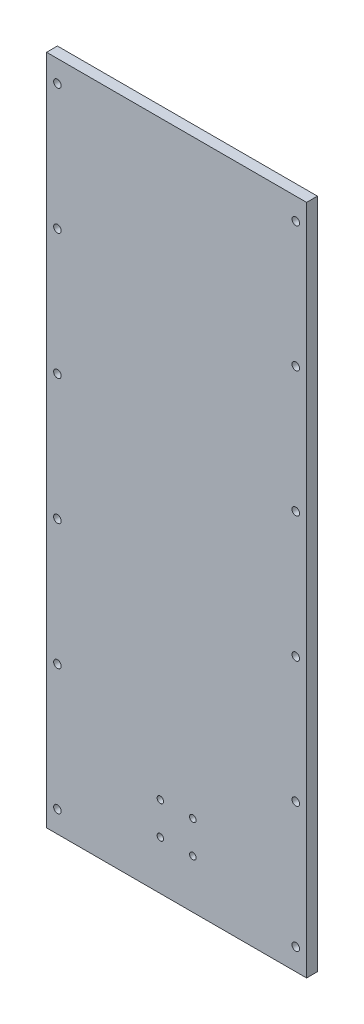
from build123d import *

# Parameters (mm, degrees)
ESQUISSE1_W             = 120
ESQUISSE1_H             = 310
BOSS_EXTRU_1_DEPTH      = 5
ESQUISSE2_R             = 1.747592995
ESQUISSE2_R_2           = 1.5
ENL_V_MAT_EXTRU_1_DEPTH = 10


with BuildPart() as part:
    # Esquisse1 → Boss.-Extru.1 (new body)
    with BuildSketch(Plane.XY):
        Rectangle(ESQUISSE1_W, ESQUISSE1_H)
    extrude(amount=BOSS_EXTRU_1_DEPTH)

    # Esquisse2 → Enlèv. mat.-Extru.1 (cut)
    with BuildSketch(Plane.XY.offset(5)):
        with Locations((-55, 145)):
            Circle(ESQUISSE2_R)
        with Locations((55, 145)):
            Circle(ESQUISSE2_R)
        with Locations((-55, 87)):
            Circle(ESQUISSE2_R)
        with Locations((-55, 29)):
            Circle(ESQUISSE2_R)
        with Locations((-55, -29)):
            Circle(ESQUISSE2_R)
        with Locations((-55, -87)):
            Circle(ESQUISSE2_R)
        with Locations((55, 87)):
            Circle(ESQUISSE2_R)
        with Locations((55, 29)):
            Circle(ESQUISSE2_R)
        with Locations((55, -29)):
            Circle(ESQUISSE2_R)
        with Locations((55, -87)):
            Circle(ESQUISSE2_R)
        with Locations((-7.5, -117.5)):
            Circle(ESQUISSE2_R_2)
        with Locations((7.5, -117.5)):
            Circle(ESQUISSE2_R_2)
        with Locations((7.5, -132.5)):
            Circle(ESQUISSE2_R_2)
        with Locations((-7.5, -132.5)):
            Circle(ESQUISSE2_R_2)
        with Locations((55, -145)):
            Circle(ESQUISSE2_R)
        with Locations((-55, -145)):
            Circle(ESQUISSE2_R)
    extrude(amount=-ENL_V_MAT_EXTRU_1_DEPTH, mode=Mode.SUBTRACT)


solid = part.part
